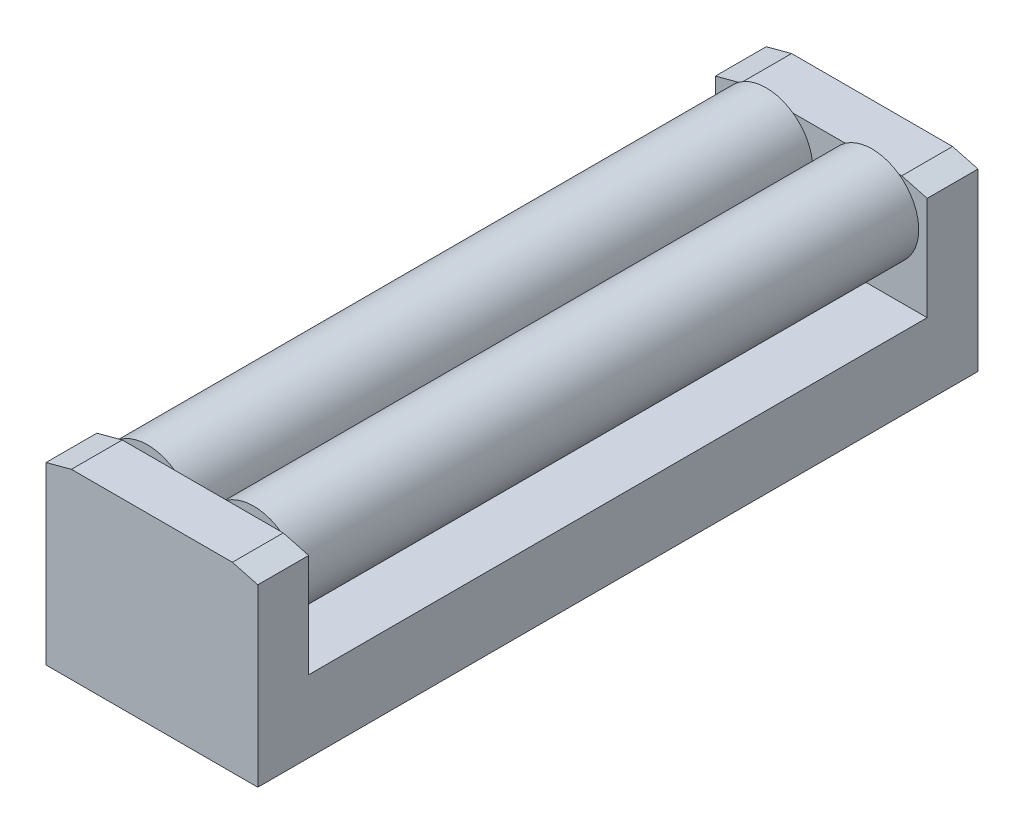
from build123d import *

# Parameters (mm, degrees)
SCHIZZO1_W               = 25
SCHIZZO1_H               = 21.5
ESTRUSIONE1_DEPTH        = 85
SCHIZZO6_W               = 73
SCHIZZO6_H               = 23.639461627
TAGLIO_ESTRUSIONE4_DEPTH = 84
SCHIZZO7_R               = 5.5
ESTRUSIONE4_DEPTH        = 73
SMUSSO1_SIZE             = 0.803847577
SMUSSO1_SIZE_2           = 3
SCHIZZO8_R               = 3
TAGLIO_ESTRUSIONE5_DEPTH = 8.5


with BuildPart() as part:
    # Schizzo1 → Estrusione1 (new body)
    with BuildSketch(Plane.XY):
        with Locations((12.5, 10.75)):
            Rectangle(SCHIZZO1_W, SCHIZZO1_H)
    extrude(amount=ESTRUSIONE1_DEPTH)

    # Schizzo6 → Taglio-Estrusione4 (cut)
    with BuildSketch(Plane(origin=(25, 0, 0), x_dir=(0, 0, -1), z_dir=(1, 0, 0))):
        with Locations((-42.5, 20.319730814)):
            Rectangle(SCHIZZO6_W, SCHIZZO6_H)
    extrude(amount=-TAGLIO_ESTRUSIONE4_DEPTH, mode=Mode.SUBTRACT)

    # Schizzo7 → Estrusione4 (add)
    with BuildSketch(Plane.XY.offset(6)):
        with Locations(Location((6, 17, 0), (0, 0, 125.096801228))):
            Circle(SCHIZZO7_R)
        with Locations(Location((18.5, 17, 0), (0, 0, 125.096801228))):
            Circle(SCHIZZO7_R)
    extrude(amount=ESTRUSIONE4_DEPTH)

    # Smusso1
    # the kernel refuses this chamfer: 3, 0.803847577 mm, written as the material it takes off along each edge
    with BuildSketch(Plane(origin=(0, 21.5, -7.790164711), x_dir=(-0.13751244702128895, -0.9905000388259545, 0), z_dir=(0, 0, 1)), Plane(origin=(0, 21.5, 79), x_dir=(-0.13751244702128895, -0.9905000388259545, 0), z_dir=(0, 0, 1))) as smusso1_piece_1:
        Polygon((SMUSSO1_SIZE * 0.990500039187, SMUSSO1_SIZE * 0.137512447071), (-SMUSSO1_SIZE_2 * 0.137512447021, SMUSSO1_SIZE_2 * 0.990500038826), (0, 0), align=None)
    extrude(amount=13.790164711, mode=Mode.SUBTRACT)
    with BuildSketch(Plane(origin=(25, 21.5, -7.790164711), x_dir=(0.13751244702128734, -0.9905000388259546, 0), z_dir=(0, 0, 1)), Plane(origin=(25, 21.5, 71.209835289), x_dir=(0.13751244702128734, -0.9905000388259546, 0), z_dir=(0, 0, 1))) as smusso1_piece_2:
        Polygon((SMUSSO1_SIZE * 0.990500039187, -SMUSSO1_SIZE * 0.137512447071), (-SMUSSO1_SIZE_2 * 0.137512447021, -SMUSSO1_SIZE_2 * 0.990500038826), (0, 0), align=None)
    extrude(amount=21.580329421, mode=Mode.SUBTRACT)

    # Schizzo8 → Taglio-Estrusione5 (cut)
    with BuildSketch(Plane.XZ):
        with Locations(Location((12, 75.5, 0), (0, 0, 270))):
            Circle(SCHIZZO8_R)
        with Locations(Location((12, 9.5, 0), (0, 0, 270))):
            Circle(SCHIZZO8_R)
    extrude(amount=-TAGLIO_ESTRUSIONE5_DEPTH, mode=Mode.SUBTRACT)


solid = part.part
